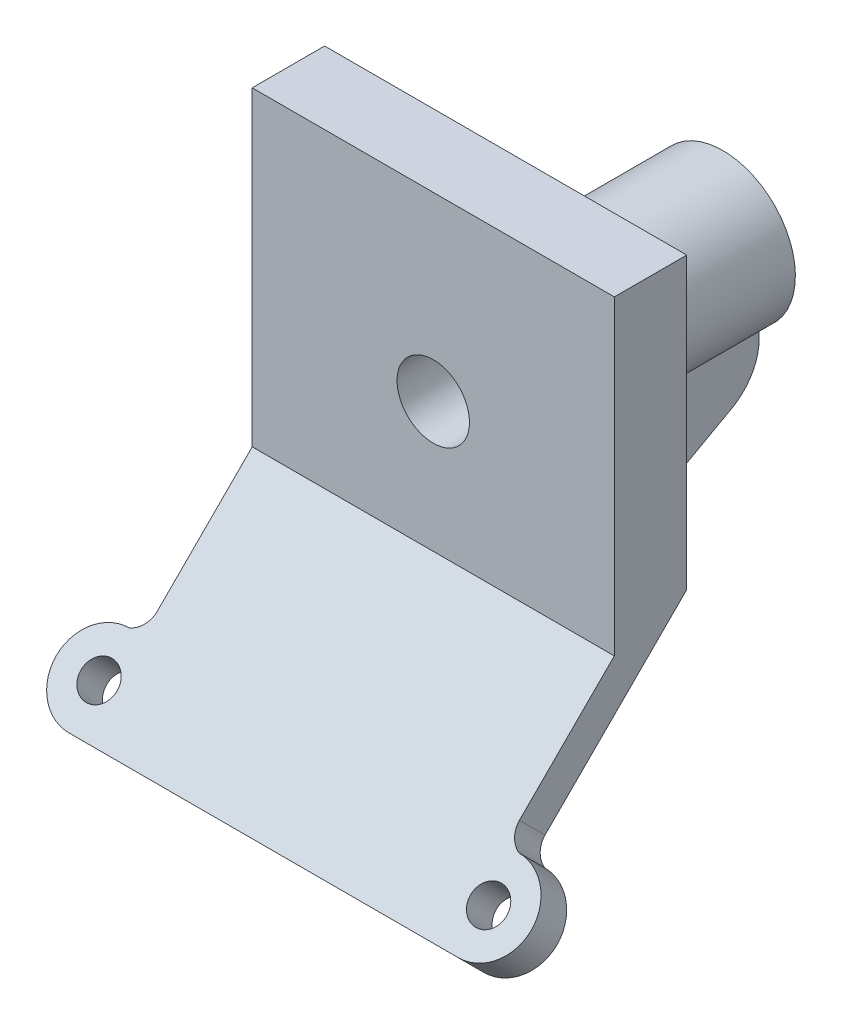
from build123d import *

# Parameters (mm, degrees)
SCHIZZO1_W                   = 50
SCHIZZO1_H                   = 50
ESTRUSIONE_ESTRUSIONE1_DEPTH = 5
SCHIZZO2_R                   = 10
ESTRUSIONE_ESTRUSIONE2_DEPTH = 30
SCHIZZO3_R                   = 5
TAGLIO_ESTRUSIONE1_DEPTH     = 69.738635424
ESTRUSIONE_ESTRUSIONE6_DEPTH = 5
ESTRUSIONE_ESTRUSIONE7_REACH = 74.379
SCHIZZO9_W                   = 50
SCHIZZO9_H                   = 5
TAGLIO_ESTRUSIONE4_DEPTH     = 85.062355977
SCHIZZO12_R                  = 2.5
TAGLIO_ESTRUSIONE5_DEPTH     = 69.505418355
NERVATURA14_START            = -5
NERVATURA14_DEPTH            = 10


with BuildPart() as part:
    # Schizzo1 → Estrusione-Estrusione1 (new, symmetric)
    with BuildSketch(Plane.XY):
        with Locations((0, 25)):
            Rectangle(SCHIZZO1_W, SCHIZZO1_H)
    extrude(amount=ESTRUSIONE_ESTRUSIONE1_DEPTH, both=True)

    # Schizzo2 → Estrusione-Estrusione2 (add)
    with BuildSketch(Plane(origin=(0, 0, -5), x_dir=(-1, 0, 0), z_dir=(0, 0, -1))):
        with Locations((0, 25)):
            Circle(SCHIZZO2_R)
    extrude(amount=ESTRUSIONE_ESTRUSIONE2_DEPTH)

    # Schizzo3 → Taglio-Estrusione1 (cut, through all)
    with BuildSketch(Plane.XY.offset(5)):
        with Locations((0, 25)):
            Circle(SCHIZZO3_R)
    extrude(amount=-TAGLIO_ESTRUSIONE1_DEPTH, mode=Mode.SUBTRACT)

    # Estrusione-Estrusione7: up to this face of the body (flat: up to its plane)
    estrusione_estrusione7_end = Plane(part.part.faces().sort_by_distance((-24.292893219, 25, 5))[0])
    # Schizzo9 → Estrusione-Estrusione7 (add, up to the picked face)
    with BuildSketch(Plane(origin=(0, -2.5, 2.5), x_dir=(1, 0, 0), z_dir=(0, 0.7071067811865465, -0.7071067811865487)), mode=Mode.PRIVATE) as estrusione_estrusione7_sk1:
        with Locations((0, -6.035533906)):
            Rectangle(SCHIZZO9_W, SCHIZZO9_H)
    estrusione_estrusione7_tool1 = split(extrude(estrusione_estrusione7_sk1.sketch, amount=ESTRUSIONE_ESTRUSIONE7_REACH, mode=Mode.PRIVATE), bisect_by=estrusione_estrusione7_end, keep=Keep.BOTH, mode=Mode.PRIVATE)


with BuildPart() as body_2:
    # Schizzo4 → Estrusione-Estrusione6 (new body)
    with BuildSketch(Plane(origin=(0, 2.5, 2.5), x_dir=(1, 0, 0), z_dir=(0, 0.7071067811865488, 0.7071067811865464))):
        with BuildLine():
            ThreePointArc((-26.89463486, -19.849691999), (-32.805533406, -25.760590545), (-26.89463486, -31.67148909))
            Line((-26.89463486, -31.67148909), (0, -31.67148909))
            Line((0, -31.67148909), (0, -3.535533906))
            Line((0, -3.535533906), (-25, -3.535533906))
            Line((-25, -3.535533906), (-25, -17.060755301))
            ThreePointArc((-25, -17.060755301), (-25.518458602, -18.746564391), (-26.89463486, -19.849691999))
        make_face()
        with BuildLine():
            Line((0, -3.535533906), (0, -31.67148909))
            Line((0, -31.67148909), (26.89463486, -31.67148909))
            ThreePointArc((26.89463486, -31.67148909), (32.805533406, -25.760590545), (26.89463486, -19.849691999))
            ThreePointArc((26.89463486, -19.849691999), (25.518458602, -18.746564391), (25, -17.060755301))
            Line((25, -17.060755301), (25, -3.535533906))
            Line((25, -3.535533906), (0, -3.535533906))
        make_face()
    extrude(amount=ESTRUSIONE_ESTRUSIONE6_DEPTH)


with BuildPart() as part_1:
    add(part.part)

    add(body_2.part)  # Estrusione-Estrusione7 merges body 2
    add(estrusione_estrusione7_tool1.solids().sort_by(Axis((0, 1.767767, 6.767767), (0, 0.7071067811865465, -0.7071067811865487)))[0])

    # Schizzo11 → Taglio-Estrusione4 (cut, through all)
    with BuildSketch(Plane.ZY.offset(25)):
        Polygon((5, 0), (-5, 0), (-5, 10), align=None)
    extrude(amount=-TAGLIO_ESTRUSIONE4_DEPTH, mode=Mode.SUBTRACT)

    # Schizzo12 → Taglio-Estrusione5 (cut, through all)
    with BuildSketch(Plane(origin=(0, 6.035533906, 6.035533906), x_dir=(1, 0, 0), z_dir=(0, 0.7071067811865486, 0.7071067811865465))):
        with Locations(Location((-26.89463486, -25.760590545, 0), (0, 0, 270))):
            Circle(SCHIZZO12_R)
    taglio_estrusione5 = extrude(amount=-TAGLIO_ESTRUSIONE5_DEPTH, mode=Mode.SUBTRACT)

    # Specchia9: Taglio-Estrusione5 across plane
    add(taglio_estrusione5.mirror(Plane(origin=(0, 0, 0), x_dir=(0, 0, 1), z_dir=(1, 0, 0))), mode=Mode.SUBTRACT)

    # Nervatura14: read off the stored shape, not the designer's step
    # Nervatura14 outline → Nervatura14 (add)
    with BuildSketch(Plane(origin=(0, 0, 0), x_dir=(0, 0, -1), z_dir=(1, 0, 0)).offset(NERVATURA14_START)):
        with BuildLine():
            Line((35, 15.045679329), (34.991975911, 16.339745962))
            Line((34.991975911, 16.339745962), (5, 16.339745962))
            Line((5, 16.339745962), (5, 10))
            Line((5, 10), (-24.894153049, -19.894153049))
            ThreePointArc((-24.894153049, -19.894153049), (-23.096604523, -20.742423587), (-21.144530268, -20.368057844))
            Line((-21.144530268, -20.368057844), (31.188764864, 8.540341978))
            ThreePointArc((31.188764864, 8.540341978), (33.987865457, 11.269552189), (35, 15.045679329))
        make_face()
    extrude(amount=NERVATURA14_DEPTH)


solid = part_1.part
